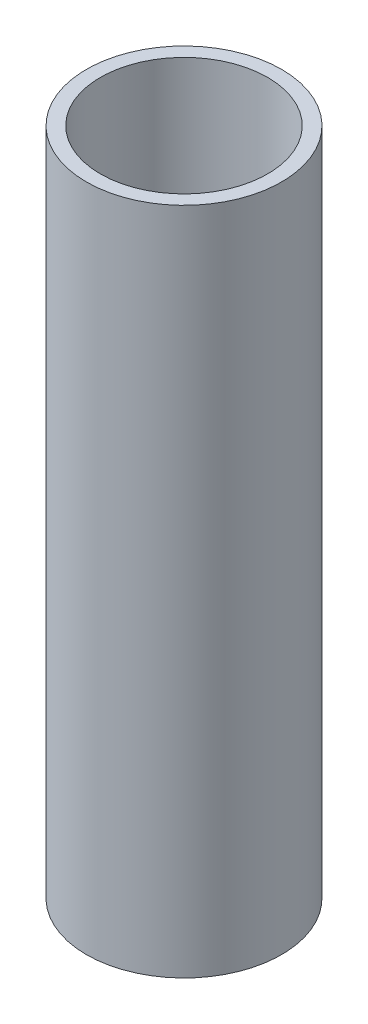
from build123d import *


with BuildPart() as part:
    # Sketch1 → body (revolve)
    with BuildSketch(Plane.XY):
        Polygon((-22.225, 0), (-22.225, -152.4), (-12.7, -152.4), (-6.35, -128.701477372), (-19.05, -116.001477372), (-19.05, 0), align=None)
    revolve(axis=Axis((0, 0, 0), (0, -1, 0)))


solid = part.part
